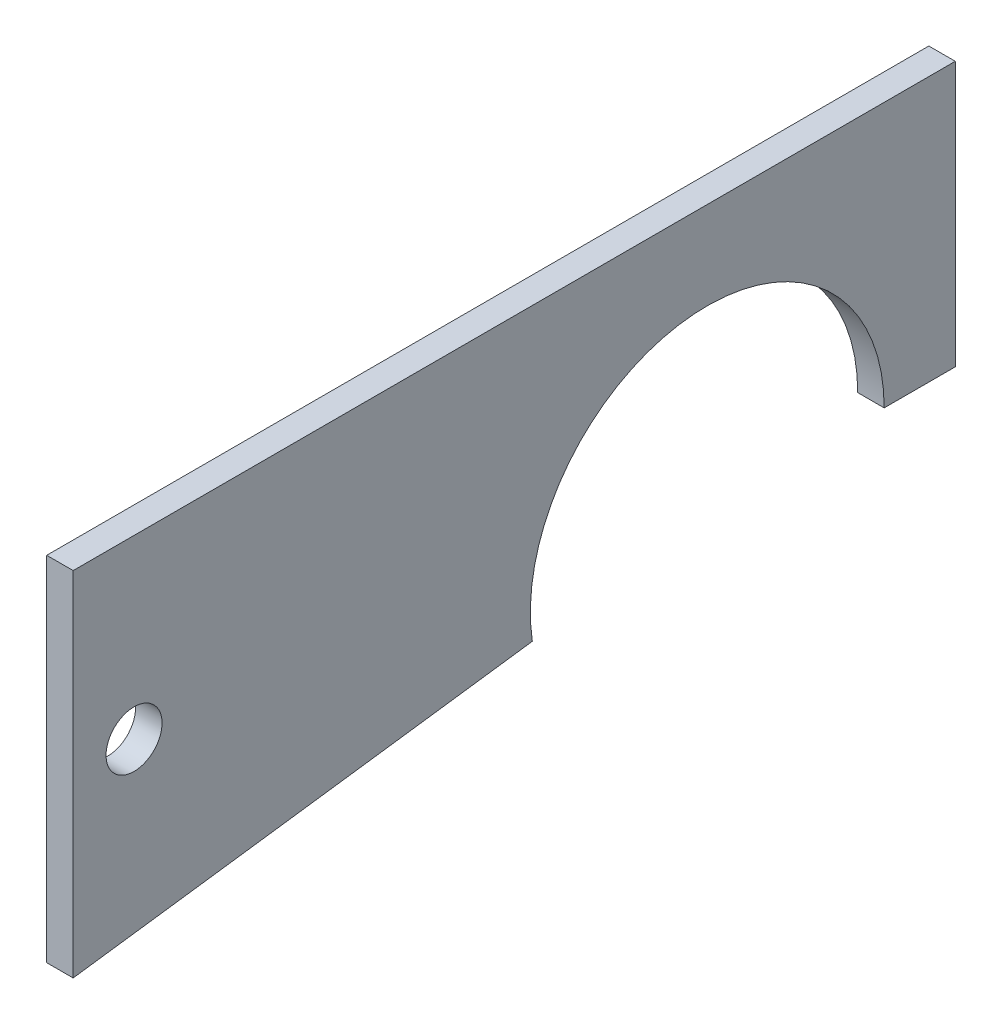
from build123d import *

# Parameters (mm, degrees)
BOSS_EXTRUDE1_DEPTH = 3
SKETCH2_R           = 3.175
CUT_EXTRUDE1_DEPTH  = 108.745069493


with BuildPart() as part:
    # Sketch1 → Boss-Extrude1 (new body)
    with BuildSketch(Plane(origin=(0, 0, 0), x_dir=(0, 0, -1), z_dir=(1, 0, 0))):
        with BuildLine():
            Line((0, 0), (100, 0))
            Line((100, 0), (100, -30))
            Line((100, -30), (91.938707928, -30))
            ThreePointArc((91.938707928, -30), (70.392758898, -10), (52.049324971, -32.972730603))
            Line((52.049324971, -32.972730603), (0, -40))
            Line((0, -40), (0, 0))
        make_face()
    extrude(amount=BOSS_EXTRUDE1_DEPTH)

    # Sketch2 → Cut-Extrude1 (cut, through all)
    with BuildSketch(Plane(origin=(3, 0, 0), x_dir=(0, 0, -1), z_dir=(1, 0, 0))):
        with Locations((6.900903962, -20)):
            Circle(SKETCH2_R)
    extrude(amount=-CUT_EXTRUDE1_DEPTH, mode=Mode.SUBTRACT)


solid = part.part
